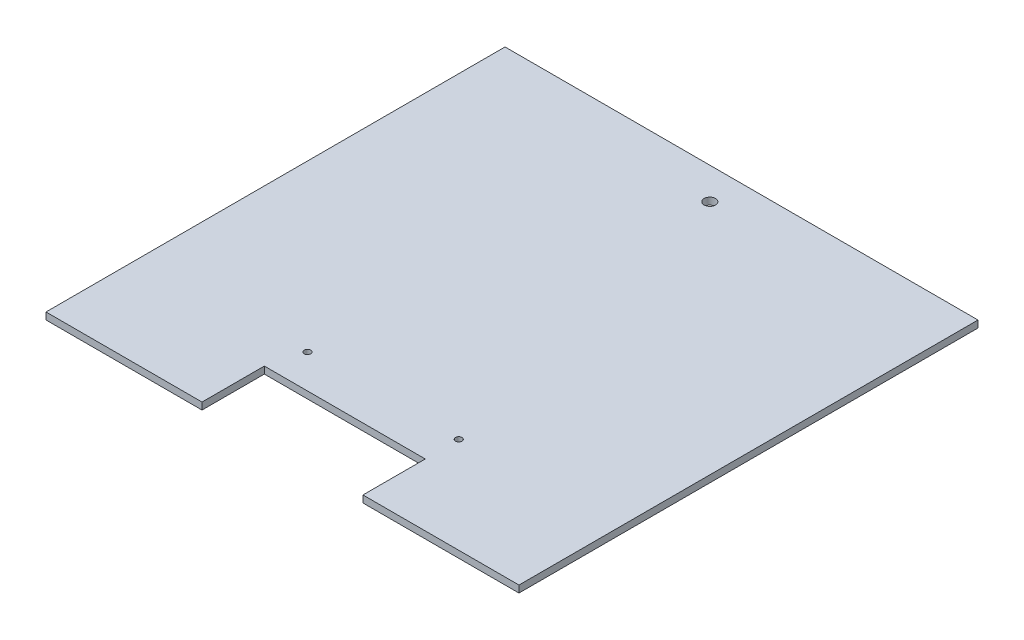
from build123d import *

# Parameters (mm, degrees)
SKETCH1_W           = 189.738
SKETCH1_H           = 184.15
BOSS_EXTRUDE1_DEPTH = 2.794
SKETCH2_R           = 2.286
CUT_EXTRUDE1_DEPTH  = 133.233653893
CUT_EXTRUDE2_DEPTH  = 133.233653893
SKETCH4_R           = 1.3
CUT_EXTRUDE4_DEPTH  = 133.233653893


with BuildPart() as part:
    # Sketch1 → Boss-Extrude1 (new body)
    with BuildSketch(Plane(origin=(0, 0, 0), x_dir=(1, 0, 0), z_dir=(0, 1, 0))):
        Rectangle(SKETCH1_W, SKETCH1_H)
    extrude(amount=BOSS_EXTRUDE1_DEPTH)

    # Sketch2 → Cut-Extrude1 (cut, through all)
    with BuildSketch(Plane(origin=(0, 2.794, 0), x_dir=(1, 0, 0), z_dir=(0, 1, 0))):
        with Locations((0, 79.375)):
            Circle(SKETCH2_R)
    extrude(amount=-CUT_EXTRUDE1_DEPTH, mode=Mode.SUBTRACT)

    # Sketch3 → Cut-Extrude2 (cut, through all)
    with BuildSketch(Plane(origin=(0, 2.794, 0), x_dir=(1, 0, 0), z_dir=(0, 1, 0))):
        Polygon((0, -92.075), (-32.28, -92.075), (-32.28, -67.074999962), (32.28, -67.074999962), (32.28, -92.075), align=None)
    extrude(amount=-CUT_EXTRUDE2_DEPTH, mode=Mode.SUBTRACT)

    # Sketch4 → Cut-Extrude4 (cut, through all)
    with BuildSketch(Plane(origin=(0, 2.794, 0), x_dir=(1, 0, 0), z_dir=(0, 1, 0))):
        with Locations((-28.54, -53.524999962)):
            Circle(SKETCH4_R)
        with Locations((32.166, -53.524999962)):
            Circle(SKETCH4_R)
    extrude(amount=-CUT_EXTRUDE4_DEPTH, mode=Mode.SUBTRACT)


solid = part.part
